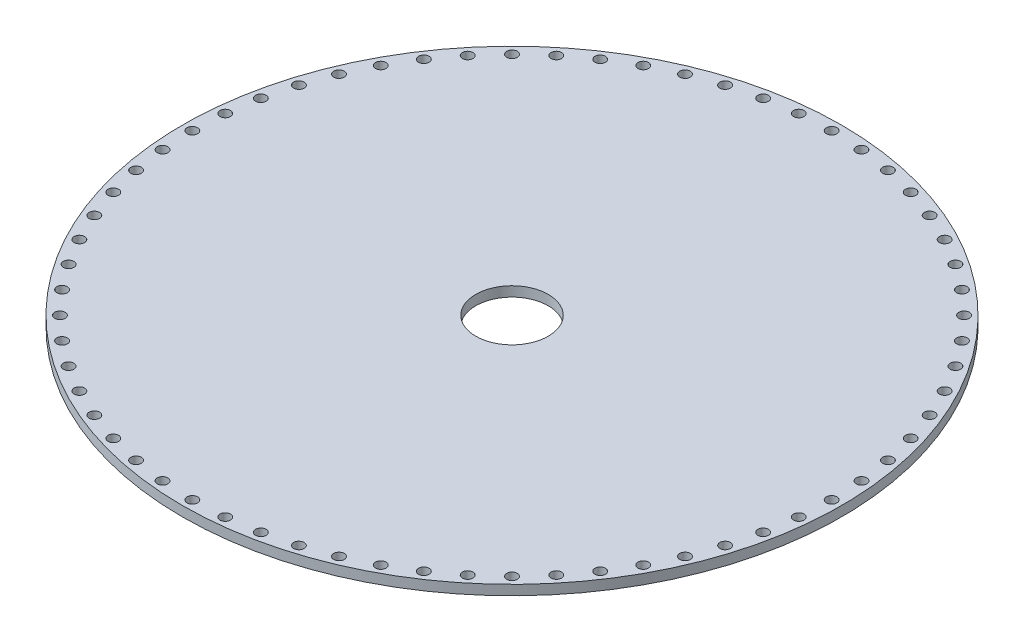
from build123d import *

# Parameters (mm, degrees)
ESQUISSE2_W                  = 100
ESQUISSE2_H                  = 3
ESQUISSE4_R                  = 11
CENTRALHOLE_DEPTH            = 142.453172464
ESQUISSE5_R                  = 1.6
FIXINGHOLE_DEPTH             = 142.453172464
R_P_TITION_CIRCULAIRE1_COUNT = 64


with BuildPart() as part:
    # Esquisse2 → MainRevolution (revolve)
    with BuildSketch(Plane.XY):
        with Locations((50, 1.5)):
            Rectangle(ESQUISSE2_W, ESQUISSE2_H)
    revolve(axis=Axis((0, 55, 0), (0, -1, 0)))

    # Esquisse4 → CentralHole (cut, through all)
    with BuildSketch(Plane(origin=(0, 3, 0), x_dir=(1, 0, 0), z_dir=(0, 1, 0))):
        Circle(ESQUISSE4_R)
    extrude(amount=-CENTRALHOLE_DEPTH, mode=Mode.SUBTRACT)

    # Esquisse5 → FixingHole (cut, through all)
    with BuildSketch(Plane(origin=(0, 3, 0), x_dir=(1, 0, 0), z_dir=(0, 1, 0))):
        with Locations((97, 0)):
            Circle(ESQUISSE5_R)
    fixinghole = extrude(amount=-FIXINGHOLE_DEPTH, mode=Mode.SUBTRACT)

    # Répétition circulaire1: FixingHole ×64 about axis
    r_p_tition_circulaire1_axis = Axis((0, 55, 0), (0, -1, 0))
    for i in range(1, R_P_TITION_CIRCULAIRE1_COUNT):
        add(fixinghole.rotate(r_p_tition_circulaire1_axis, i * 360 / R_P_TITION_CIRCULAIRE1_COUNT), mode=Mode.SUBTRACT)


solid = part.part
